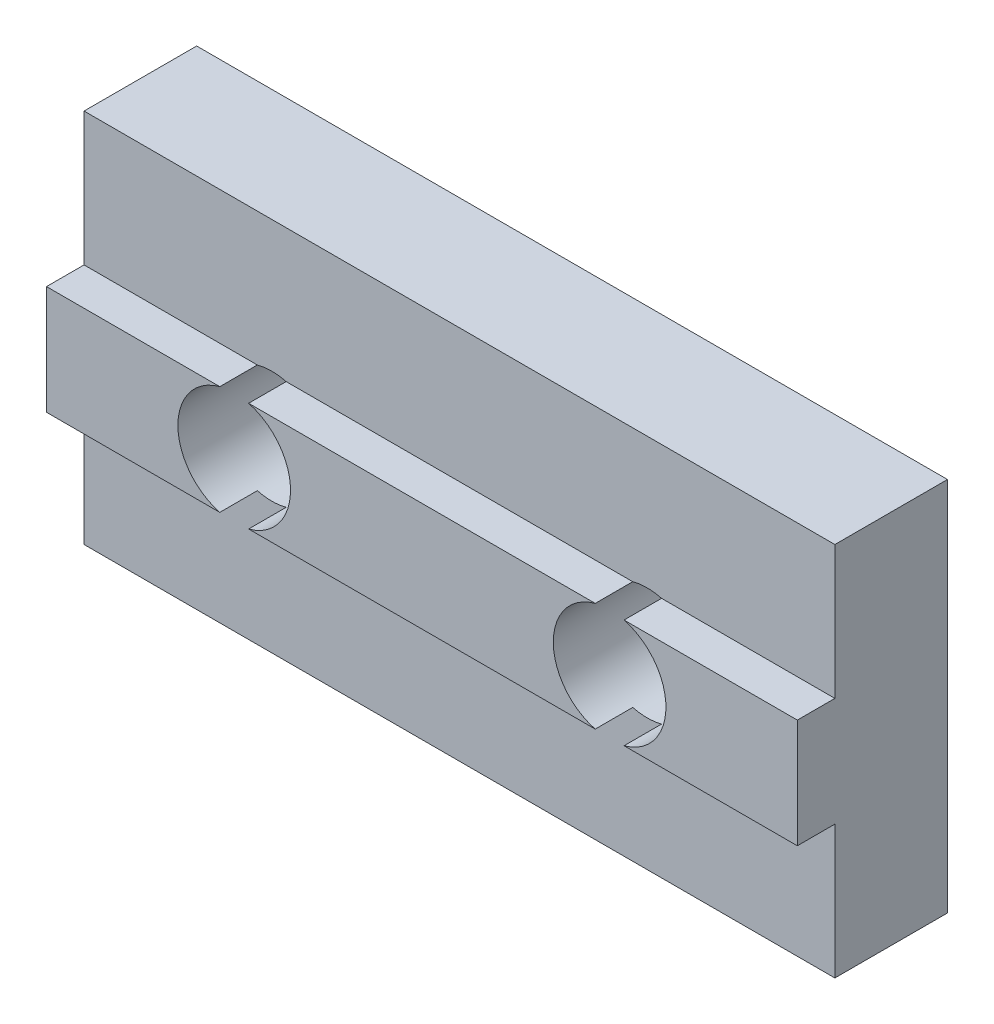
from build123d import *

# Parameters (mm, degrees)
ESQUISSE1_W                = 20
ESQUISSE1_H                = 10
BOSS_EXTRU_1_DEPTH         = 3
ESQUISSE2_W                = 20
ESQUISSE2_H                = 2.9
BOSS_EXTRU_2_DEPTH         = 1
ESQUISSE3_R                = 1.5
ENL_V_MAT_EXTRU_1_DEPTH    = 23.715633383
R_P_TITION_LIN_AIRE1_COUNT = 2
R_P_TITION_LIN_AIRE1_PITCH = 10


with BuildPart() as part:
    # Esquisse1 → Boss.-Extru.1 (new body)
    with BuildSketch(Plane.XY):
        with Locations((10, 5)):
            Rectangle(ESQUISSE1_W, ESQUISSE1_H)
    extrude(amount=BOSS_EXTRU_1_DEPTH)

    # Esquisse2 → Boss.-Extru.2 (add)
    with BuildSketch(Plane.XY.offset(3)):
        with Locations((10, 5)):
            Rectangle(ESQUISSE2_W, ESQUISSE2_H)
    extrude(amount=BOSS_EXTRU_2_DEPTH)

    # Esquisse3 → Enlèv. mat.-Extru.1 (cut, through all)
    with BuildSketch(Plane(origin=(0, 0, 0), x_dir=(-1, 0, 0), z_dir=(0, 0, -1))):
        with Locations((-15, 5)):
            Circle(ESQUISSE3_R)
    enl_v_mat_extru_1 = extrude(amount=-ENL_V_MAT_EXTRU_1_DEPTH, mode=Mode.SUBTRACT)

    # Répétition linéaire1: Enlèv. mat.-Extru.1 ×2
    with Locations(*[(-i * R_P_TITION_LIN_AIRE1_PITCH, 0, 0) for i in range(1, R_P_TITION_LIN_AIRE1_COUNT)]):
        add(enl_v_mat_extru_1, mode=Mode.SUBTRACT)


solid = part.part
